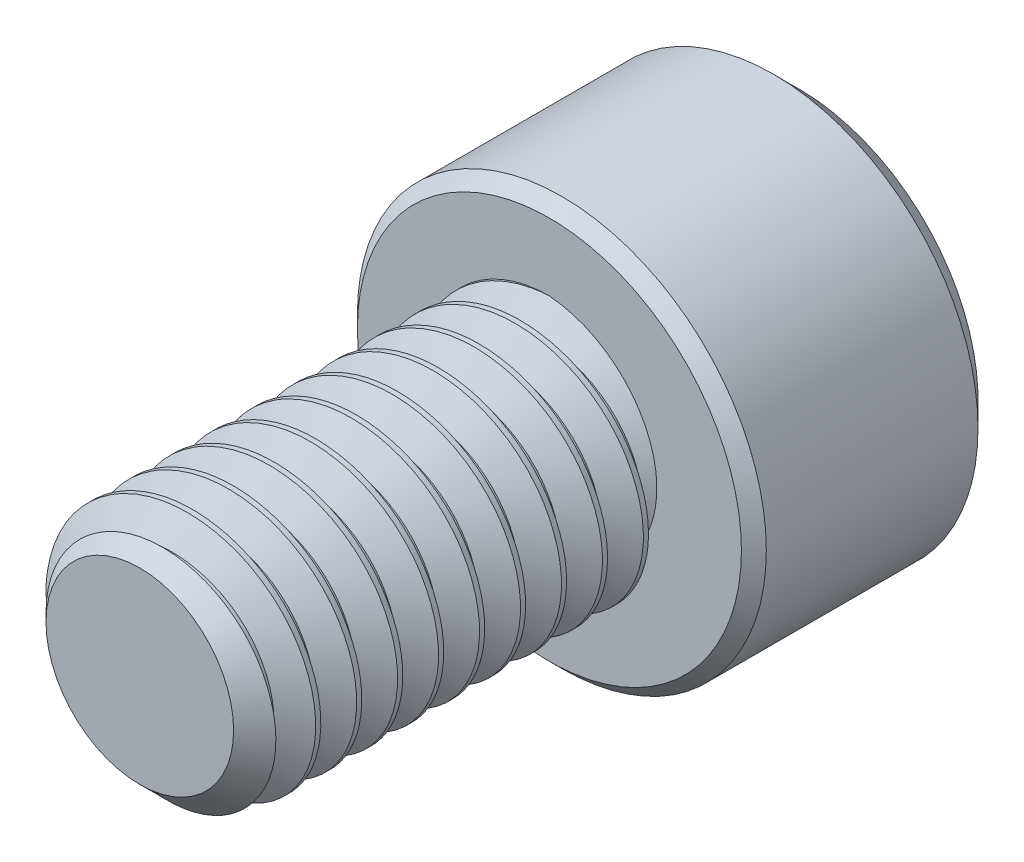
from build123d import *

# Parameters (mm, degrees)
SKETCH1_R          = 2.413
EXTRUDE1_DEPTH     = 7.9375
CHAMFER3_SIZE      = 0.5953125
CUT_SWEEP1_PITCH   = 0.79375
SKETCH6_R          = 3.9624
EXTRUDE2_DEPTH     = 4.826
CUT_EXTRUDE1_DEPTH = 2.9765625
SKETCH8_R          = 2.291358881
CUT_EXTRUDE2_DEPTH = 0.4826
CUT_EXTRUDE2_DRAFT = -45
CHAMFER1_SIZE      = 0.4826
CHAMFER2_SIZE      = 0.2413


with BuildPart() as part:
    # Sketch1 → Extrude1 (new body)
    with BuildSketch(Plane.XY):
        Circle(SKETCH1_R)
    extrude(amount=-EXTRUDE1_DEPTH)

    # Chamfer3
    chamfer3_edges = [part.edges().sort_by_distance(p)[0] for p in [
        (-2.413, 0, 0),
    ]]
    chamfer(chamfer3_edges, length=CHAMFER3_SIZE)

    # Cut-Sweep1: the profile of Sketch3 profile screwed along a right-hand helix of 11 turns, 6 arcs to a turn; built about Z, then put on its axis
    cut_sweep1_z = Axis((0, 0, 0), (0, 0, 1))
    cut_sweep1_corners = [(2.4133, 0, -0.694704455), (1.897444252, 0, -0.396875), (1.897444252, 0, -0.29765625), (2.4133, 0, 0.000173205)]
    with BuildLine(mode=Mode.PRIVATE) as cut_sweep1_profile:
        Line(cut_sweep1_corners[0], cut_sweep1_corners[1])
        Line(cut_sweep1_corners[1], cut_sweep1_corners[2])
        Line(cut_sweep1_corners[2], cut_sweep1_corners[3])
        Line(cut_sweep1_corners[3], cut_sweep1_corners[0])
    cut_sweep1_cap = Face(cut_sweep1_profile.wire())
    cut_sweep1_turn_angles = [0, 30, 60, 90, 120, 150, 180, 210, 240, 270, 300, 330, 360]
    cut_sweep1_turn_weights = [1, 0.8660254037844387, 1, 0.8660254037844387, 1, 0.8660254037844387, 1, 0.8660254037844387, 1, 0.8660254037844387, 1, 0.8660254037844387, 1]
    cut_sweep1_turn_rails = [Edge.make_bspline([Vector(p[0], p[1], 0).rotate(cut_sweep1_z, cut_sweep1_turn_angles[k]) / cut_sweep1_turn_weights[k] + Vector(0, 0, p[2] + CUT_SWEEP1_PITCH * cut_sweep1_turn_angles[k] / 360) for k in range(13)], [0, 0, 0, 1, 1, 2, 2, 3, 3, 4, 4, 5, 5, 6, 6, 6], 2, cut_sweep1_turn_weights) for p in cut_sweep1_corners]
    cut_sweep1_turn_sides = [Face.make_surface_from_curves(cut_sweep1_turn_rails[p[0]], cut_sweep1_turn_rails[p[1]]) for p in [(0, 1), (1, 2), (2, 3), (3, 0)]]
    cut_sweep1 = Plane(origin=(0, 0, 0), x_dir=(0, 1, 0), z_dir=(0, 0, -1)) * Solid(Shell([*[p.moved(Location((0, 0, CUT_SWEEP1_PITCH * i))) for i in range(11) for p in cut_sweep1_turn_sides], cut_sweep1_cap, cut_sweep1_cap.rotate(cut_sweep1_z, 3960).moved(Location((0, 0, CUT_SWEEP1_PITCH * 3960 / 360)))]))
    add(cut_sweep1, mode=Mode.SUBTRACT)

    # Sketch6 → Extrude2 (add)
    with BuildSketch(Plane(origin=(0, 0, -7.9375), x_dir=(-1, 0, 0), z_dir=(0, 0, -1))):
        Circle(SKETCH6_R)
    extrude(amount=EXTRUDE2_DEPTH)

    # Sketch7 → Cut-Extrude1 (cut)
    with BuildSketch(Plane(origin=(0, 0, -12.7635), x_dir=(-1, 0, 0), z_dir=(0, 0, -1))):
        Polygon((0, 2.291358881), (-1.984375, 1.14567944), (-1.984375, -1.14567944), (0, -2.291358881), (1.984375, -1.14567944), (1.984375, 1.14567944), align=None)
    extrude(amount=-CUT_EXTRUDE1_DEPTH, mode=Mode.SUBTRACT)


with BuildPart() as cut_extrude2_tool:
    # Sketch8 → Cut-Extrude2 (with draft: the straight prism first)
    with BuildSketch(Plane(origin=(0, 0, -12.7635), x_dir=(-1, 0, 0), z_dir=(0, 0, -1))):
        Circle(SKETCH8_R)
    extrude(amount=-CUT_EXTRUDE2_DEPTH)
    # Cut-Extrude2: the draft: its side faces are tilted about the plane it starts from
    cut_extrude2_sides = [cut_extrude2_tool.faces().sort_by_distance(p)[0] for p in [
        (2.291358881, 0, -12.5222),
    ]]
    draft(cut_extrude2_sides, Plane(origin=(0, 0, -12.7635), x_dir=(-1, 0, 0), z_dir=(0, 0, -1)), CUT_EXTRUDE2_DRAFT)


with BuildPart() as part_1:
    add(part.part)

    # Cut-Extrude2: cut by cut_extrude2_tool
    add(cut_extrude2_tool.part, mode=Mode.SUBTRACT)

    # Chamfer1
    chamfer1_edges = [part_1.edges().sort_by_distance(p)[0] for p in [
        (3.9624, 0, -12.7635),
    ]]
    chamfer(chamfer1_edges, length=CHAMFER1_SIZE)

    # Chamfer2
    chamfer2_edges = [part_1.edges().sort_by_distance(p)[0] for p in [
        (3.9624, 0, -7.9375),
    ]]
    chamfer(chamfer2_edges, length=CHAMFER2_SIZE)


solid = part_1.part
